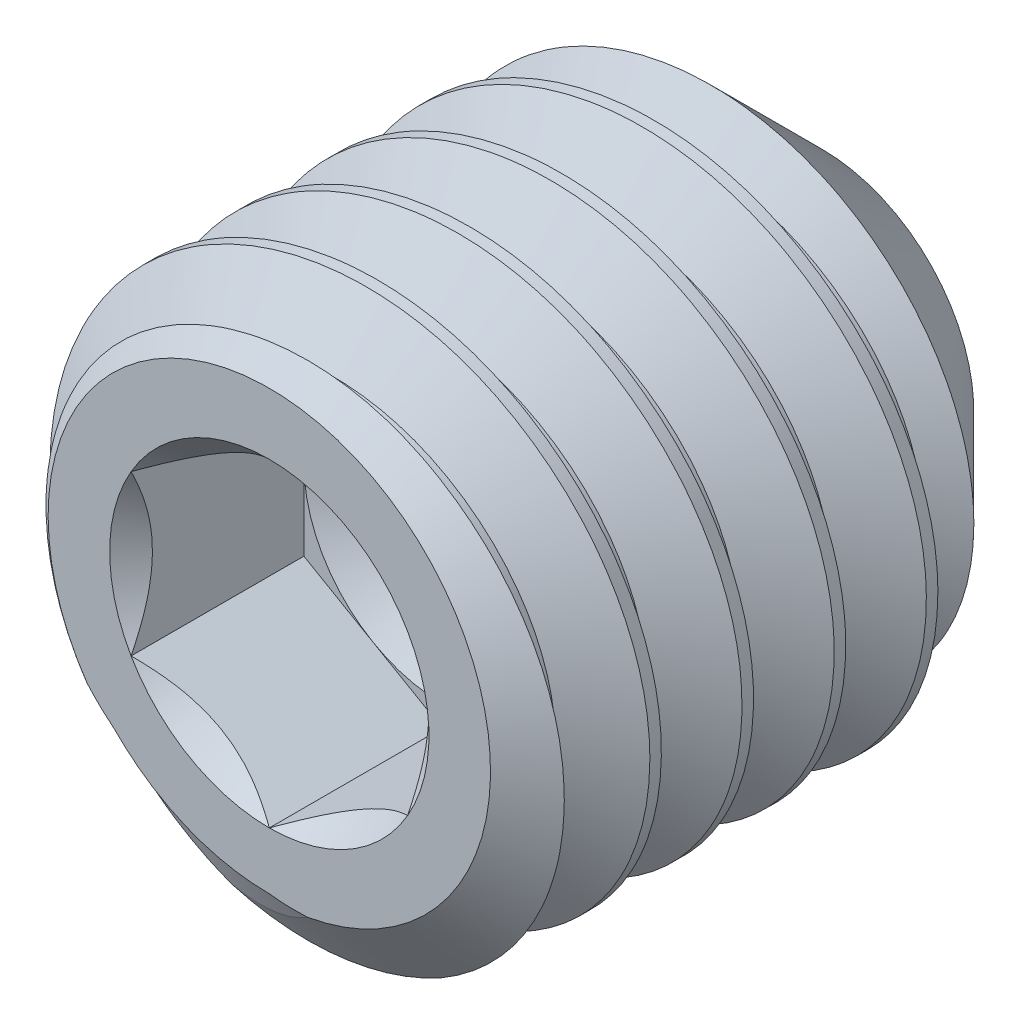
from build123d import *

# Parameters (mm, degrees)
CUT_SWEEP2_PITCH    = 0.5
CUT_EXTRUDE10_DEPTH = 0.9375


with BuildPart() as part:
    # Sketch22 → Revolve1 (revolve)
    with BuildSketch(Plane(origin=(0, 0, 0), x_dir=(0, 0, -1), z_dir=(1, 0, 0)), mode=Mode.PRIVATE) as revolve1_sk:
        Polygon((-1.2530621, 0), (-1.2530621, 1.2), (-1.042999839, 1.5), (1.068885259, 1.5), (1.7469379, 0.821947359), (1.2530621, 0), align=None)
    revolve(revolve1_sk.sketch.rotate(Axis((0, 0, -1.2530621), (0, 0, -1)), 180), axis=Axis((0, 0, -1.2530621), (0, 0, -1)))

    # Cut-Sweep2: arcs per turn and ends read off the stored shape
    # Cut-Sweep2: the profile of Sketch28 profile screwed along a right-hand helix through 7 turns, 6 arcs to a turn; built about Z, then put on its axis
    cut_sweep2_z = Axis((0, 0, 0), (0, 0, 1))
    cut_sweep2_corners = [(1.5003, -2.62e-07, -0.124826809), (1.5003, -2.62e-07, -0.562673219), (1.175240474, -2.05e-07, -0.375000014), (1.175240474, -2.05e-07, -0.312500014)]
    with BuildLine(mode=Mode.PRIVATE) as cut_sweep2_profile:
        Line(cut_sweep2_corners[0], cut_sweep2_corners[1])
        Line(cut_sweep2_corners[1], cut_sweep2_corners[2])
        Line(cut_sweep2_corners[2], cut_sweep2_corners[3])
        Line(cut_sweep2_corners[3], cut_sweep2_corners[0])
    cut_sweep2_cap = Face(cut_sweep2_profile.wire())
    cut_sweep2_turn_angles = [0, 30, 60, 90, 120, 150, 180, 210, 240, 270, 300, 330, 360]
    cut_sweep2_turn_weights = [1, 0.8660254037844387, 1, 0.8660254037844387, 1, 0.8660254037844387, 1, 0.8660254037844387, 1, 0.8660254037844387, 1, 0.8660254037844387, 1]
    cut_sweep2_turn_rails = [Edge.make_bspline([Vector(p[0], p[1], 0).rotate(cut_sweep2_z, cut_sweep2_turn_angles[k]) / cut_sweep2_turn_weights[k] + Vector(0, 0, p[2] + CUT_SWEEP2_PITCH * cut_sweep2_turn_angles[k] / 360) for k in range(13)], [0, 0, 0, 1, 1, 2, 2, 3, 3, 4, 4, 5, 5, 6, 6, 6], 2, cut_sweep2_turn_weights) for p in cut_sweep2_corners]
    cut_sweep2_turn_sides = [Face.make_surface_from_curves(cut_sweep2_turn_rails[p[0]], cut_sweep2_turn_rails[p[1]]) for p in [(0, 1), (1, 2), (2, 3), (3, 0)]]
    cut_sweep2 = Plane(origin=(0, 0, -1.7469379), x_dir=(1, 0, 0), z_dir=(0, 0, 1)) * Solid(Shell([*[p.moved(Location((0, 0, CUT_SWEEP2_PITCH * i))) for i in range(7) for p in cut_sweep2_turn_sides], cut_sweep2_cap, cut_sweep2_cap.rotate(cut_sweep2_z, 2520).moved(Location((0, 0, CUT_SWEEP2_PITCH * 2520 / 360)))]))
    add(cut_sweep2, mode=Mode.SUBTRACT)

    # Sketch23 → Cut-Extrude10 (cut)
    with BuildSketch(Plane.XY.offset(1.2530621)):
        Polygon((0, 0.866025404), (-0.75, 0.433012702), (-0.75, -0.433012702), (0, -0.866025404), (0.75, -0.433012702), (0.75, 0.433012702), align=None)
    extrude(amount=-CUT_EXTRUDE10_DEPTH, mode=Mode.SUBTRACT)

    # Cut-Extrude11 cone 1 section (through the dimple's axis) → Cut-Extrude11 (revolve, cut)
    with BuildSketch(Plane(origin=(0, 0, 1.2530621), x_dir=(0, -1, 0), z_dir=(1, 0, 0))):
        Polygon((0, 0), (0.866025404, 0), (0, 0.866025404), align=None)
    revolve(axis=Axis((0, 0, 1.2530621), (0, 0, -1)), mode=Mode.SUBTRACT)

    # Cut-Extrude12 cone 1 section (through the dimple's axis) → Cut-Extrude12 (revolve, cut)
    with BuildSketch(Plane(origin=(0, 0, 0.3155621), x_dir=(0, -1, 0), z_dir=(1, 0, 0))):
        Polygon((0, 0), (0.75, 0), (0, 0.433012702), align=None)
    revolve(axis=Axis((0, 0, 0.3155621), (0, 0, -1)), mode=Mode.SUBTRACT)


solid = part.part
